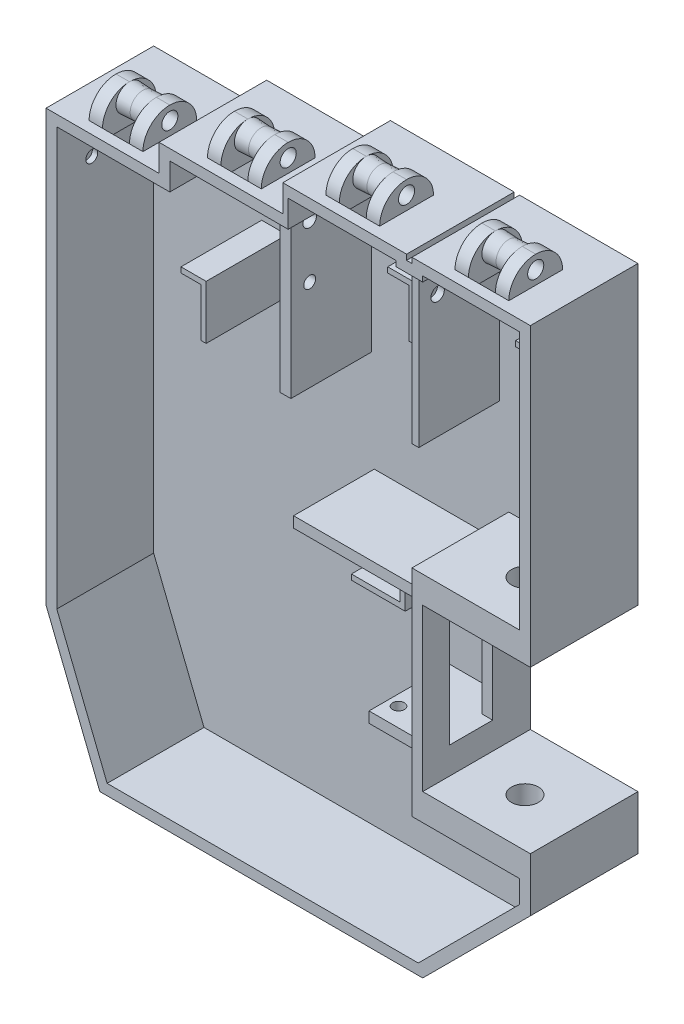
from build123d import *

# Parameters (mm, degrees)
BOSS_EXTRUDE1_DEPTH       = 20
SKETCH2_W                 = 20
SKETCH2_H                 = 30
CUT_EXTRUDE1_DEPTH        = 142.509716981
SHELL1_T                  = -2
SHELL1_THICKNESS_2_FACE_W = 20
SHELL1_THICKNESS_2_FACE_H = 18
SHELL1_THICKNESS_2_DEPTH  = 3
SHELL1_THICKNESS_3_FACE_W = 18
SHELL1_THICKNESS_3_FACE_H = 20
SHELL1_THICKNESS_3_DEPTH  = 3
SKETCH42_W                = 1.26968537
SKETCH42_H                = 30
BOSS_EXTRUDE16_DEPTH      = 15
SKETCH45_W                = 2
SKETCH45_H                = 30
BOSS_EXTRUDE17_DEPTH      = 15
CUT_EXTRUDE15_DEPTH       = 1
CUT_EXTRUDE15_DEPTH_BACK  = 51
SKETCH40_R                = 1.25
SKETCH41_W                = 8
SKETCH41_H                = 20
CUT_EXTRUDE16_DEPTH       = 10
SKETCH44_W                = 1
SKETCH44_H                = 5
CUT_EXTRUDE18_DEPTH       = 18
BOSS_EXTRUDE18_DEPTH      = 15
CUT_EXTRUDE19_DEPTH       = 44.5
CUT_EXTRUDE19_DEPTH_BACK  = 1
SKETCH47_R                = 1.1
SKETCH50_W                = 25
SKETCH50_H                = 2
BOSS_EXTRUDE19_DEPTH      = 15
SKETCH51_W                = 10.975395667
SKETCH51_H                = 2
BOSS_EXTRUDE20_DEPTH      = 15
BOSS_EXTRUDE21_DEPTH      = 5
CUT_EXTRUDE21_DEPTH       = 33.5
CUT_EXTRUDE21_DEPTH_BACK  = 1
SKETCH53_R                = 1.1
CUT_EXTRUDE14_REACH       = 107
SKETCH34_R                = 2.5
SKETCH3_W                 = 2.5
SKETCH3_H                 = 10
BOSS_EXTRUDE2_DEPTH       = 5
FILLET2_R                 = 5
CUT_EXTRUDE3_REACH        = 149.838
SKETCH6_R                 = 1.5
SKETCH21_R                = 2.5
SKETCH21_R_2              = 1.5
BOSS_EXTRUDE10_DEPTH      = 2.5
BOSS_EXTRUDE10_DRAFT      = 3
MIRROR7_COPY_1_SKETCH_R   = 2.5
MIRROR7_COPY_1_SKETCH_R_2 = 1.5
MIRROR7_COPY_1_DEPTH      = 2.5
MIRROR7_COPY_1_DRAFT      = 3
SKETCH26_W                = 5
SKETCH26_H                = 10
CUT_EXTRUDE8_DEPTH        = 2
SKETCH7_W                 = 2.5
SKETCH7_H                 = 10
BOSS_EXTRUDE4_DEPTH       = 5
FILLET4_R                 = 5
SKETCH22_R                = 2.5
BOSS_EXTRUDE11_DEPTH      = 2.5
BOSS_EXTRUDE11_TAPER      = 3
SKETCH23_R                = 1.5
CUT_EXTRUDE7_DEPTH        = 10
CUT_EXTRUDE9_REACH        = 143.51
SKETCH27_W                = 5
SKETCH27_H                = 10
SKETCH10_W                = 2.5
SKETCH10_H                = 10
BOSS_EXTRUDE6_DEPTH       = 5
FILLET6_R                 = 5
SKETCH28_R                = 2.5
BOSS_EXTRUDE12_DEPTH      = 2.5
BOSS_EXTRUDE12_TAPER      = 3
SKETCH29_R                = 1.5
CUT_EXTRUDE10_DEPTH       = 10
SKETCH30_W                = 5
SKETCH30_H                = 10
CUT_EXTRUDE11_DEPTH       = 2
SKETCH13_W                = 2.5
SKETCH13_H                = 10
BOSS_EXTRUDE8_DEPTH       = 5
FILLET8_R                 = 5
SKETCH31_R                = 2.5
BOSS_EXTRUDE13_DEPTH      = 2.5
BOSS_EXTRUDE13_TAPER      = 3
SKETCH32_R                = 1.5
CUT_EXTRUDE12_DEPTH       = 10
SKETCH33_W                = 5
SKETCH33_H                = 10
CUT_EXTRUDE13_DEPTH       = 2


with BuildPart() as part:
    # Sketch1 → Boss-Extrude1 (new body)
    with BuildSketch(Plane.XY):
        Polygon((58, 114), (58, 115), (80, 115), (80, 20), (60, 0), (0, 0), (-10, 25), (-10, 105), (11, 105), (11, 110), (12, 110), (34, 110), (34, 115), (35, 115), (57, 115), (57, 114), align=None)
    extrude(amount=BOSS_EXTRUDE1_DEPTH)

    # Sketch2 → Cut-Extrude1 (cut, through all)
    with BuildSketch(Plane.XY.offset(20)):
        with Locations((70, 45)):
            Rectangle(SKETCH2_W, SKETCH2_H)
    extrude(amount=-CUT_EXTRUDE1_DEPTH, mode=Mode.SUBTRACT)

    # Shell1
    shell1_openings = [part.faces().sort_by_distance(p)[0] for p in [
        (33.373630802, 58.203978459, 20),
    ]]
    offset(amount=SHELL1_T, openings=shell1_openings, kind=Kind.INTERSECTION)

    # Shell1 thickness 2 face (on inner face of the shell) → Shell1 thickness 2 (add)
    with BuildSketch(Plane(origin=(68, 28, 11), x_dir=(1, 0, 0), z_dir=(0, 1, 0))):
        Rectangle(SHELL1_THICKNESS_2_FACE_W, SHELL1_THICKNESS_2_FACE_H)
    extrude(amount=-SHELL1_THICKNESS_2_DEPTH)

    # Shell1 thickness 3 face (on inner face of the shell) → Shell1 thickness 3 (add)
    with BuildSketch(Plane(origin=(68, 62, 11), x_dir=(0, 0, -1), z_dir=(0, -1, 0))):
        Rectangle(SHELL1_THICKNESS_3_FACE_W, SHELL1_THICKNESS_3_FACE_H)
    extrude(amount=-SHELL1_THICKNESS_3_DEPTH)

    # Sketch42 → Boss-Extrude16 (add)
    with BuildSketch(Plane.XY.offset(2)):
        with Locations((55.634842685, 97)):
            Rectangle(SKETCH42_W, SKETCH42_H)
    extrude(amount=BOSS_EXTRUDE16_DEPTH)

    # Sketch45 → Boss-Extrude17 (add)
    with BuildSketch(Plane.XY.offset(2)):
        with Locations((31.497271128, 93)):
            Rectangle(SKETCH45_W, SKETCH45_H)
    extrude(amount=BOSS_EXTRUDE17_DEPTH)

    # Sketch40 → Cut-Extrude15 (cut, two sides: drawn at the far end of the back side and taken through both)
    with BuildSketch(Plane(origin=(78, 0, 0), x_dir=(0, 0, -1), z_dir=(1, 0, 0)).offset(-CUT_EXTRUDE15_DEPTH_BACK)):
        with Locations(Location((-13.5, 105, 0), (0, 0, 90))):
            Circle(SKETCH40_R)
    extrude(amount=CUT_EXTRUDE15_DEPTH + CUT_EXTRUDE15_DEPTH_BACK, mode=Mode.SUBTRACT)

    # Sketch41 → Cut-Extrude16 (cut)
    with BuildSketch(Plane.ZY.offset(-58)):
        with Locations((11, 45)):
            Rectangle(SKETCH41_W, SKETCH41_H)
    extrude(amount=-CUT_EXTRUDE16_DEPTH, mode=Mode.SUBTRACT)

    # Sketch44 → Cut-Extrude18 (cut)
    with BuildSketch(Plane.XY.offset(20)):
        with Locations((35.5, 110.5)):
            Rectangle(SKETCH44_W, SKETCH44_H)
    extrude(amount=-CUT_EXTRUDE18_DEPTH, mode=Mode.SUBTRACT)

    # Sketch46 → Boss-Extrude18 (add)
    with BuildSketch(Plane.XY.offset(2)):
        Polygon((12.078813568, 88), (12.078813568, 89), (16.75, 89), (16.75, 79), (15.75, 79), (15.75, 88), align=None)
    extrude(amount=BOSS_EXTRUDE18_DEPTH)

    # Sketch47 → Cut-Extrude19 (cut, two sides: drawn at the far end of the back side and taken through both)
    with BuildSketch(Plane(origin=(-8, 0, 0), x_dir=(0, 0, -1), z_dir=(1, 0, 0)).offset(-CUT_EXTRUDE19_DEPTH_BACK)):
        with Locations(Location((-13.5, 95, 0), (0, 0, 270))):
            Circle(SKETCH47_R)
    extrude(amount=CUT_EXTRUDE19_DEPTH + CUT_EXTRUDE19_DEPTH_BACK, mode=Mode.SUBTRACT)

    # Sketch50 → Boss-Extrude19 (add)
    with BuildSketch(Plane.XY.offset(2)):
        with Locations((45.5, 58.4)):
            Rectangle(SKETCH50_W, SKETCH50_H)
    extrude(amount=BOSS_EXTRUDE19_DEPTH)

    # Sketch51 → Boss-Extrude20 (add)
    with BuildSketch(Plane.XY.offset(2)):
        with Locations((52.512302167, 34)):
            Rectangle(SKETCH51_W, SKETCH51_H)
    extrude(amount=BOSS_EXTRUDE20_DEPTH)

    # Sketch52 → Boss-Extrude21 (add)
    with BuildSketch(Plane.XY.offset(2)):
        Polygon((42.748392928, 49.4), (43.748392928, 49.4), (43.748392928, 44.4), (33.748392928, 44.4), (33.748392928, 45.4), (42.748392928, 45.4), align=None)
        Polygon((40.497271128, 97.212593004), (40.497271128, 98.212593004), (45.497271128, 98.212593004), (45.497271128, 88.212593004), (44.497271128, 88.226881517), (44.497271128, 97.212593004), align=None)
        Polygon((64.269685369, 97.226881517), (64.269685369, 98.226881517), (69.269685369, 98.226881517), (69.269685369, 88.226881517), (68.269685369, 88.226881517), (68.269685369, 97.226881517), align=None)
    extrude(amount=BOSS_EXTRUDE21_DEPTH)

    # Sketch53 → Cut-Extrude21 (cut, two sides: drawn at the far end of the back side and taken through both)
    with BuildSketch(Plane.XZ.offset(-57.4).offset(-CUT_EXTRUDE21_DEPTH_BACK)):
        with Locations(Location((49, 13.5, 0), (0, 0, 270))):
            Circle(SKETCH53_R)
    extrude(amount=CUT_EXTRUDE21_DEPTH + CUT_EXTRUDE21_DEPTH_BACK, mode=Mode.SUBTRACT)

    # Cut-Extrude14: up to this face of the body (flat: up to its plane)
    cut_extrude14_end = Plane(part.part.faces().sort_by_distance((68, 25, 11))[0])
    # Sketch34 → Cut-Extrude14 (cut, up to the picked face)
    with BuildSketch(Plane(origin=(0, 65, 0), x_dir=(1, 0, 0), z_dir=(0, 1, 0)), mode=Mode.PRIVATE) as cut_extrude14_sk1:
        with Locations(Location((70, -11, 0), (0, 0, 270))):
            Circle(SKETCH34_R)
    cut_extrude14_tool1 = split(extrude(cut_extrude14_sk1.sketch, amount=-CUT_EXTRUDE14_REACH, mode=Mode.PRIVATE), bisect_by=cut_extrude14_end, keep=Keep.BOTH, mode=Mode.PRIVATE)
    add(cut_extrude14_tool1.solids().sort_by(Axis((70, 65, 11), (0, -1, 0)))[0], mode=Mode.SUBTRACT)

    # Sketch3 → Boss-Extrude2 (add)
    with BuildSketch(Plane(origin=(0, 115, 0), x_dir=(1, 0, 0), z_dir=(0, 1, 0))):
        with Locations((65.25, -13)):
            Rectangle(SKETCH3_W, SKETCH3_H)
        with Locations((72.75, -13)):
            Rectangle(SKETCH3_W, SKETCH3_H)
    extrude(amount=BOSS_EXTRUDE2_DEPTH)

    # Fillet2
    fillet2_edges = [part.edges().sort_by_distance(p)[0] for p in [
        (65.25, 120, 8),
        (65.25, 120, 18),
        (72.75, 120, 8),
        (72.75, 120, 18),
    ]]
    fillet(fillet2_edges, radius=FILLET2_R - 0.0001)  # a hair under: the kernel refuses the full size

    # Cut-Extrude3: up to this face of the body (flat: up to its plane)
    cut_extrude3_end = Plane(part.part.faces().sort_by_distance((64, 117.122079053, 13))[0])
    # Sketch6 → Cut-Extrude3 (cut, up to the picked face)
    with BuildSketch(Plane(origin=(74, 0, 0), x_dir=(0, 0, -1), z_dir=(1, 0, 0)), mode=Mode.PRIVATE) as cut_extrude3_sk1:
        with Locations((-13, 117.5)):
            Circle(SKETCH6_R)
    cut_extrude3_tool1 = split(extrude(cut_extrude3_sk1.sketch, amount=-CUT_EXTRUDE3_REACH, mode=Mode.PRIVATE), bisect_by=cut_extrude3_end, keep=Keep.BOTH, mode=Mode.PRIVATE)
    add(cut_extrude3_tool1.solids().sort_by(Axis((74, 117.5, 13), (-1, 0, 0)))[0], mode=Mode.SUBTRACT)


with BuildPart() as boss_extrude10_tool:
    # Sketch21 → Boss-Extrude10 (with draft: the straight prism first)
    with BuildSketch(Plane(origin=(66.5, 0, 0), x_dir=(0, 0, -1), z_dir=(1, 0, 0))):
        with Locations((-13, 117.5)):
            Circle(SKETCH21_R)
        with Locations((-13, 117.5)):
            Circle(SKETCH21_R_2, mode=Mode.SUBTRACT)
    extrude(amount=BOSS_EXTRUDE10_DEPTH)
    # Boss-Extrude10: the draft: its side faces are tilted about the plane it starts from
    boss_extrude10_sides = [boss_extrude10_tool.faces().sort_by_distance(p)[0] for p in [
        (67.75, 117.5, 15.5),
        (67.75, 117.5, 14.5),
    ]]
    draft(boss_extrude10_sides, Plane(origin=(66.5, 0, 0), x_dir=(0, 0, -1), z_dir=(1, 0, 0)), BOSS_EXTRUDE10_DRAFT)


with BuildPart() as part_1:
    add(part.part)

    # Boss-Extrude10: add boss_extrude10_tool
    add(boss_extrude10_tool.part)


with BuildPart() as mirror7_copy_1_tool:
    # Mirror7 copy 1 sketch → Mirror7 copy 1 (with draft: the straight prism first)
    with BuildSketch(Plane(origin=(71.5, 0, 0), x_dir=(0, 0, -1), z_dir=(-1, 0, 0))):
        with Locations((-13, -117.5)):
            Circle(MIRROR7_COPY_1_SKETCH_R)
        with Locations((-13, -117.5)):
            Circle(MIRROR7_COPY_1_SKETCH_R_2, mode=Mode.SUBTRACT)
    extrude(amount=MIRROR7_COPY_1_DEPTH)
    # Mirror7 copy 1: the draft: its side faces are tilted about the plane it starts from
    mirror7_copy_1_sides = [mirror7_copy_1_tool.faces().sort_by_distance(p)[0] for p in [
        (70.25, 117.5, 15.5),
        (70.25, 117.5, 14.5),
    ]]
    draft(mirror7_copy_1_sides, Plane(origin=(71.5, 0, 0), x_dir=(0, 0, -1), z_dir=(-1, 0, 0)), MIRROR7_COPY_1_DRAFT)


with BuildPart() as part_2:
    add(part_1.part)

    # Mirror7 copy 1: add mirror7_copy_1_tool
    add(mirror7_copy_1_tool.part)

    # Sketch26 → Cut-Extrude8 (cut)
    with BuildSketch(Plane(origin=(0, 115, 0), x_dir=(1, 0, 0), z_dir=(0, 1, 0))):
        with Locations((69, -13)):
            Rectangle(SKETCH26_W, SKETCH26_H)
    extrude(amount=-CUT_EXTRUDE8_DEPTH, mode=Mode.SUBTRACT)

    # Sketch7 → Boss-Extrude4 (add)
    with BuildSketch(Plane(origin=(0, 115, 0), x_dir=(1, 0, 0), z_dir=(0, 1, 0))):
        with Locations((41.25, -13)):
            Rectangle(SKETCH7_W, SKETCH7_H)
        with Locations((48.75, -13)):
            Rectangle(SKETCH7_W, SKETCH7_H)
    extrude(amount=BOSS_EXTRUDE4_DEPTH)

    # Fillet4
    fillet4_edges = [part_2.edges().sort_by_distance(p)[0] for p in [
        (41.25, 120, 8),
        (41.25, 120, 18),
        (48.75, 120, 8),
        (48.75, 120, 18),
    ]]
    fillet(fillet4_edges, radius=FILLET4_R - 0.0001)  # a hair under: the kernel refuses the full size

    # Sketch22 → Boss-Extrude11 (add)
    with BuildSketch(Plane(origin=(42.5, 0, 0), x_dir=(0, 0, -1), z_dir=(1, 0, 0))):
        with Locations((-13, 117.5)):
            Circle(SKETCH22_R)
    boss_extrude11 = extrude(amount=BOSS_EXTRUDE11_DEPTH, taper=BOSS_EXTRUDE11_TAPER)

    # Mirror8: Boss-Extrude11 across plane
    add(boss_extrude11.mirror(Plane(origin=(45, 117.5, 13), x_dir=(0, 0, 1), z_dir=(1, 0, 0))))

    # Sketch23 → Cut-Extrude7 (cut)
    with BuildSketch(Plane(origin=(50, 0, 0), x_dir=(0, 0, -1), z_dir=(1, 0, 0))):
        with Locations((-13, 117.5)):
            Circle(SKETCH23_R)
    extrude(amount=-CUT_EXTRUDE7_DEPTH, mode=Mode.SUBTRACT)

    # Sketch27 → Cut-Extrude9 (cut, up to next)
    with BuildSketch(Plane(origin=(0, 115, 0), x_dir=(1, 0, 0), z_dir=(0, 1, 0)), mode=Mode.PRIVATE) as cut_extrude9_sk1:
        with Locations((45, -13)):
            Rectangle(SKETCH27_W, SKETCH27_H)
    cut_extrude9_tool1 = extrude(cut_extrude9_sk1.sketch, amount=-CUT_EXTRUDE9_REACH, mode=Mode.PRIVATE) & part_2.part
    add(cut_extrude9_tool1.solids().sort_by_distance((45, 115, 13))[0], mode=Mode.SUBTRACT)

    # Sketch10 → Boss-Extrude6 (add)
    with BuildSketch(Plane(origin=(0, 110, 0), x_dir=(1, 0, 0), z_dir=(0, 1, 0))):
        with Locations((19.25, -13)):
            Rectangle(SKETCH10_W, SKETCH10_H)
        with Locations((26.75, -13)):
            Rectangle(SKETCH10_W, SKETCH10_H)
    extrude(amount=BOSS_EXTRUDE6_DEPTH)

    # Fillet6
    fillet6_edges = [part_2.edges().sort_by_distance(p)[0] for p in [
        (19.25, 115, 18),
        (19.25, 115, 8),
        (26.75, 115, 8),
        (26.75, 115, 18),
    ]]
    fillet(fillet6_edges, radius=FILLET6_R - 0.0001)  # a hair under: the kernel refuses the full size

    # Sketch28 → Boss-Extrude12 (add)
    with BuildSketch(Plane(origin=(20.5, 0, 0), x_dir=(0, 0, -1), z_dir=(1, 0, 0))):
        with Locations((-13, 112.5)):
            Circle(SKETCH28_R)
    boss_extrude12 = extrude(amount=BOSS_EXTRUDE12_DEPTH, taper=BOSS_EXTRUDE12_TAPER)

    # Mirror9: Boss-Extrude12 across plane
    add(boss_extrude12.mirror(Plane(origin=(23, 112.5, 13), x_dir=(0, 0, 1), z_dir=(1, 0, 0))))

    # Sketch29 → Cut-Extrude10 (cut)
    with BuildSketch(Plane(origin=(28, 0, 0), x_dir=(0, 0, -1), z_dir=(1, 0, 0))):
        with Locations((-13, 112.5)):
            Circle(SKETCH29_R)
    extrude(amount=-CUT_EXTRUDE10_DEPTH, mode=Mode.SUBTRACT)

    # Sketch30 → Cut-Extrude11 (cut)
    with BuildSketch(Plane(origin=(0, 110, 0), x_dir=(1, 0, 0), z_dir=(0, 1, 0))):
        with Locations((23, -13)):
            Rectangle(SKETCH30_W, SKETCH30_H)
    extrude(amount=-CUT_EXTRUDE11_DEPTH, mode=Mode.SUBTRACT)

    # Sketch13 → Boss-Extrude8 (add)
    with BuildSketch(Plane(origin=(0, 105, 0), x_dir=(1, 0, 0), z_dir=(0, 1, 0))):
        with Locations((-2.75, -13)):
            Rectangle(SKETCH13_W, SKETCH13_H)
        with Locations((4.75, -13)):
            Rectangle(SKETCH13_W, SKETCH13_H)
    extrude(amount=BOSS_EXTRUDE8_DEPTH)

    # Fillet8
    fillet8_edges = [part_2.edges().sort_by_distance(p)[0] for p in [
        (-2.75, 110, 18),
        (-2.75, 110, 8),
        (4.75, 110, 8),
        (4.75, 110, 18),
    ]]
    fillet(fillet8_edges, radius=FILLET8_R - 0.0001)  # a hair under: the kernel refuses the full size

    # Sketch31 → Boss-Extrude13 (add)
    with BuildSketch(Plane(origin=(-1.5, 0, 0), x_dir=(0, 0, -1), z_dir=(1, 0, 0))):
        with Locations((-13, 107.5)):
            Circle(SKETCH31_R)
    boss_extrude13 = extrude(amount=BOSS_EXTRUDE13_DEPTH, taper=BOSS_EXTRUDE13_TAPER)

    # Mirror10: Boss-Extrude13 across plane
    add(boss_extrude13.mirror(Plane(origin=(1, 107.5, 13), x_dir=(0, 0, 1), z_dir=(1, 0, 0))))

    # Sketch32 → Cut-Extrude12 (cut)
    with BuildSketch(Plane(origin=(6, 0, 0), x_dir=(0, 0, -1), z_dir=(1, 0, 0))):
        with Locations((-13, 107.5)):
            Circle(SKETCH32_R)
    extrude(amount=-CUT_EXTRUDE12_DEPTH, mode=Mode.SUBTRACT)

    # Sketch33 → Cut-Extrude13 (cut)
    with BuildSketch(Plane(origin=(0, 105, 0), x_dir=(1, 0, 0), z_dir=(0, 1, 0))):
        with Locations((1, -13)):
            Rectangle(SKETCH33_W, SKETCH33_H)
    extrude(amount=-CUT_EXTRUDE13_DEPTH, mode=Mode.SUBTRACT)


solid = part_2.part
